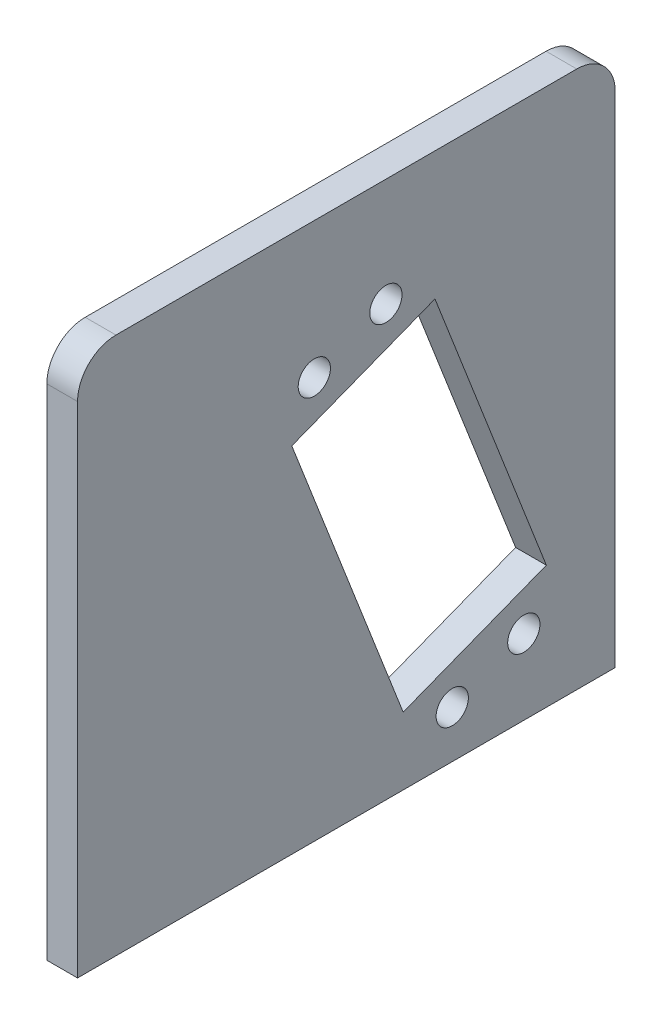
from build123d import *

# Parameters (mm, degrees)
SKETCH1_W           = 4
SKETCH1_H           = 70
BOSS_EXTRUDE1_DEPTH = 3
SKETCH1_3_W         = 4
SKETCH1_3_H         = 70
BOSS_EXTRUDE2_DEPTH = 70
FILLET2_R           = 5
SKETCH8_R           = 2.5
CUT_EXTRUDE8_DEPTH  = 10
SKETCH35_R          = 2.1
SKETCH35_R_2        = 3.5
CUT_EXTRUDE20_DEPTH = 10
SKETCH36_R          = 5.103129577
CUT_EXTRUDE21_DEPTH = 10


with BuildPart() as part:
    # Sketch1 → Boss-Extrude1 (new body)
    with BuildSketch(Plane(origin=(0, 0, 0), x_dir=(1, 0, 0), z_dir=(0, 1, 0))):
        with Locations((37.228694968, 4.212548619)):
            Rectangle(SKETCH1_W, SKETCH1_H)
    extrude(amount=BOSS_EXTRUDE1_DEPTH)

    # Sketch1<3> → Boss-Extrude2 (add)
    with BuildSketch(Plane(origin=(0, 0, 0), x_dir=(1, 0, 0), z_dir=(0, 1, 0))):
        with Locations((37.228694968, 4.212548619)):
            Rectangle(SKETCH1_3_W, SKETCH1_3_H)
    extrude(amount=BOSS_EXTRUDE2_DEPTH)

    # Fillet2
    fillet2_edges = [part.edges().sort_by_distance(p)[0] for p in [
        (37.228694968, 70, -39.212548619),
        (37.228694968, 70, 30.787451381),
    ]]
    fillet(fillet2_edges, radius=FILLET2_R)

    # Sketch8 → Cut-Extrude8 (cut)
    with BuildSketch(Plane(origin=(39.228694968, 0, 0), x_dir=(0, 0, -1), z_dir=(1, 0, 0))):
        with Locations((8.02072759, 38.893893193)):
            Circle(SKETCH8_R)
    extrude(amount=-CUT_EXTRUDE8_DEPTH, mode=Mode.SUBTRACT)

    # Sketch35 → Cut-Extrude20 (cut)
    # profile 1 of 5: a face of its own
    with BuildSketch(Plane(origin=(39.228694968, 0, 0), x_dir=(0, 0, -1), z_dir=(1, 0, 0))):
        with Locations((9.360883449, 55.927975545)):
            Circle(SKETCH35_R)
    # profile 2 of 5: a face of its own
    with BuildSketch(Plane(origin=(39.228694968, 0, 0), x_dir=(0, 0, -1), z_dir=(1, 0, 0))):
        with Locations((0.041460347, 52.301909763)):
            Circle(SKETCH35_R)
    # profile 3 of 5: a face of its own
    with BuildSketch(Plane(origin=(39.228694968, 0, 0), x_dir=(0, 0, -1), z_dir=(1, 0, 0))):
        with Locations((27.317161202, 9.778192346)):
            Circle(SKETCH35_R)
    # profile 4 of 5: a face of its own
    with BuildSketch(Plane(origin=(39.228694968, 0, 0), x_dir=(0, 0, -1), z_dir=(1, 0, 0))):
        with Locations((17.997738101, 6.152126564)):
            Circle(SKETCH35_R)
    # profile 5 of 5: a face of its own
    with BuildSketch(Plane(origin=(39.228694968, 0, 0), x_dir=(0, 0, -1), z_dir=(1, 0, 0))):
        Polygon((15.746602312, 53.304963039), (30.250865441, 16.027270634), (11.612019238, 8.775139069), (-2.892243891, 46.052831475), align=None)
        with Locations((8.02072759, 38.893893193)):
            Circle(SKETCH35_R_2, mode=Mode.SUBTRACT)
    extrude(amount=-CUT_EXTRUDE20_DEPTH, mode=Mode.SUBTRACT)


with BuildPart() as cut_extrude20_piece_1:
    # of the separate pieces the step leaves, piece 1, a body of its own (cut_extrude20_pieces)
    add(part.part.solids().sort_by_distance((39.228694968, 65, 30.787451381))[0])


with BuildPart() as cut_extrude20_piece_2:
    # of the separate pieces the step leaves, piece 2, a body of its own (cut_extrude20_pieces)
    add(part.part.solids().sort_by_distance((39.228694968, 38.893893193, -11.52072759))[0])

    # Sketch36 → Cut-Extrude21 (cut)
    with BuildSketch(Plane(origin=(39.228694968, 0, 0), x_dir=(0, 0, -1), z_dir=(1, 0, 0))):
        with Locations((8.02072759, 38.893893193)):
            Circle(SKETCH36_R)
    extrude(amount=-CUT_EXTRUDE21_DEPTH, mode=Mode.SUBTRACT)


solid = cut_extrude20_piece_1.part
